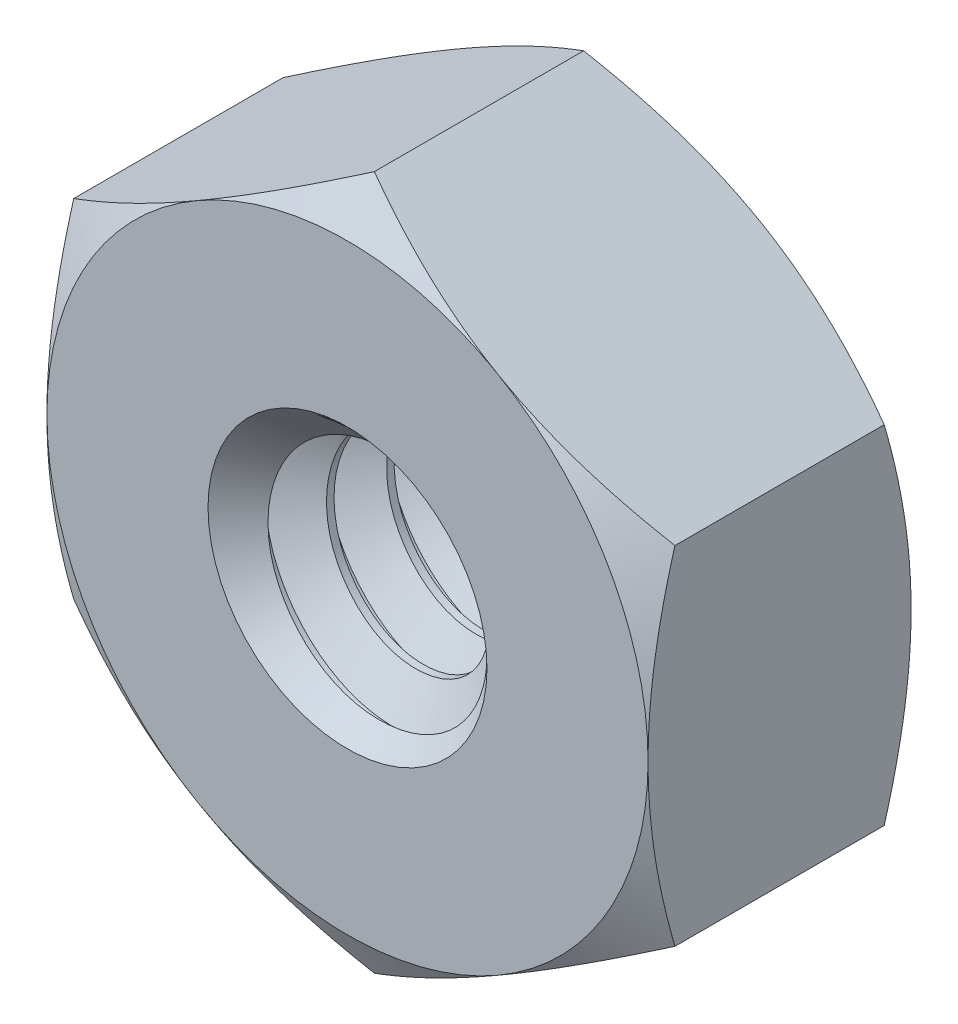
from build123d import *

# Parameters (mm, degrees)
EXTRUDE1_DEPTH     = 2.778125
SKETCH2_OUTSIDE_W  = 33.194
SKETCH2_OUTSIDE_H  = 34.176
SKETCH2_OUTSIDE_R  = 3.175
CUT_EXTRUDE6_DEPTH = 6.589225067
CUT_EXTRUDE6_DRAFT = -60
SKETCH4_OUTSIDE_W  = 32.366
SKETCH4_OUTSIDE_H  = 33.348
SKETCH4_OUTSIDE_R  = 3.175
CUT_EXTRUDE3_DEPTH = 6.35
CUT_EXTRUDE3_DRAFT = -60
SKETCH5_R          = 1.4224
CUT_EXTRUDE4_DEPTH = 6.589225067
SWEEP1_PITCH       = 0.635
SKETCH8_R          = 1.9304
CUT_EXTRUDE5_DEPTH = 8.990379213
CUT_EXTRUDE8_DEPTH = 6.589225173


with BuildPart() as part:
    # Sketch1 → Extrude1 (new body)
    with BuildSketch(Plane.XY):
        Polygon((0, 3.666174209), (-3.175, 1.833087105), (-3.175, -1.833087105), (0, -3.666174209), (3.175, -1.833087105), (3.175, 1.833087105), align=None)
    extrude(amount=-EXTRUDE1_DEPTH)


with BuildPart() as cut_extrude6_tool:
    # Sketch2 outside → Cut-Extrude6 (with draft: the straight prism first)
    with BuildSketch(Plane.XY):
        Rectangle(SKETCH2_OUTSIDE_W, SKETCH2_OUTSIDE_H)
        Circle(SKETCH2_OUTSIDE_R, mode=Mode.SUBTRACT)
    extrude(amount=-CUT_EXTRUDE6_DEPTH)
    # Cut-Extrude6: the draft: its side faces are tilted about the plane it starts from
    cut_extrude6_sides = [cut_extrude6_tool.faces().sort_by_distance(p)[0] for p in [
        (0, -17.088, -3.294612533),
        (16.597, 0, -3.294612533),
        (0, 17.088, -3.294612533),
        (-16.597, 0, -3.294612533),
        (-3.175, 0, -3.294612533),
    ]]
    draft(cut_extrude6_sides, Plane.XY, CUT_EXTRUDE6_DRAFT)


with BuildPart() as part_1:
    add(part.part)

    # Cut-Extrude6: cut by cut_extrude6_tool
    add(cut_extrude6_tool.part, mode=Mode.SUBTRACT)


with BuildPart() as cut_extrude3_tool:
    # Sketch4 outside → Cut-Extrude3 (with draft: the straight prism first)
    with BuildSketch(Plane(origin=(0, 0, -2.778125), x_dir=(-1, 0, 0), z_dir=(0, 0, -1))):
        Rectangle(SKETCH4_OUTSIDE_W, SKETCH4_OUTSIDE_H)
        Circle(SKETCH4_OUTSIDE_R, mode=Mode.SUBTRACT)
    extrude(amount=-CUT_EXTRUDE3_DEPTH)
    # Cut-Extrude3: the draft: its side faces are tilted about the plane it starts from
    cut_extrude3_sides = [cut_extrude3_tool.faces().sort_by_distance(p)[0] for p in [
        (0, -16.674, 0.396875),
        (-16.183, 0, 0.396875),
        (0, 16.674, 0.396875),
        (16.183, 0, 0.396875),
        (3.175, 0, 0.396875),
    ]]
    draft(cut_extrude3_sides, Plane(origin=(0, 0, -2.778125), x_dir=(-1, 0, 0), z_dir=(0, 0, -1)), CUT_EXTRUDE3_DRAFT)


with BuildPart() as part_2:
    add(part_1.part)

    # Cut-Extrude3: cut by cut_extrude3_tool
    add(cut_extrude3_tool.part, mode=Mode.SUBTRACT)

    # Sketch5 → Cut-Extrude4 (cut, through all)
    with BuildSketch(Plane.XY):
        Circle(SKETCH5_R)
    extrude(amount=-CUT_EXTRUDE4_DEPTH, mode=Mode.SUBTRACT)

    # Sweep1: the profile of Sketch7 profile screwed along a right-hand helix of 14.375 turns, 6 arcs to a turn; built about Z, then put on its axis
    sweep1_z = Axis((0, 0, 0), (0, 0, 1))
    sweep1_corners = [(1.4227, 0, -0.555798205), (1.4227, 0, 0.000173205), (1.009955401, 0, -0.238125), (1.009955401, 0, -0.3175)]
    with BuildLine(mode=Mode.PRIVATE) as sweep1_profile:
        Line(sweep1_corners[0], sweep1_corners[1])
        Line(sweep1_corners[1], sweep1_corners[2])
        Line(sweep1_corners[2], sweep1_corners[3])
        Line(sweep1_corners[3], sweep1_corners[0])
    sweep1_cap = Face(sweep1_profile.wire())
    sweep1_turn_angles = [0, 30, 60, 90, 120, 150, 180, 210, 240, 270, 300, 330, 360]
    sweep1_turn_weights = [1, 0.8660254037844387, 1, 0.8660254037844387, 1, 0.8660254037844387, 1, 0.8660254037844387, 1, 0.8660254037844387, 1, 0.8660254037844387, 1]
    sweep1_turn_rails = [Edge.make_bspline([Vector(p[0], p[1], 0).rotate(sweep1_z, sweep1_turn_angles[k]) / sweep1_turn_weights[k] + Vector(0, 0, p[2] + SWEEP1_PITCH * sweep1_turn_angles[k] / 360) for k in range(13)], [0, 0, 0, 1, 1, 2, 2, 3, 3, 4, 4, 5, 5, 6, 6, 6], 2, sweep1_turn_weights) for p in sweep1_corners]
    sweep1_turn_sides = [Face.make_surface_from_curves(sweep1_turn_rails[p[0]], sweep1_turn_rails[p[1]]) for p in [(0, 1), (1, 2), (2, 3), (3, 0)]]
    sweep1_turn = Solid(Shell([*sweep1_turn_sides, sweep1_cap, sweep1_cap.rotate(sweep1_z, 360).moved(Location((0, 0, SWEEP1_PITCH * 360 / 360)))]))
    sweep1_last_angles = [5040, 5070, 5100, 5130, 5160, 5167.5, 5175]
    sweep1_last_weights = [1, 0.8660254037844387, 1, 0.8660254037844387, 1, 0.9914448613738001, 1]
    sweep1_last_rails = [Edge.make_bspline([Vector(p[0], p[1], 0).rotate(sweep1_z, sweep1_last_angles[k]) / sweep1_last_weights[k] + Vector(0, 0, p[2] + SWEEP1_PITCH * sweep1_last_angles[k] / 360) for k in range(7)], [0, 0, 0, 1, 1, 2, 2, 3, 3, 3], 2, sweep1_last_weights) for p in sweep1_corners]
    sweep1_last_sides = [Face.make_surface_from_curves(sweep1_last_rails[p[0]], sweep1_last_rails[p[1]]) for p in [(0, 1), (1, 2), (2, 3), (3, 0)]]
    sweep1_last = Solid(Shell([*sweep1_last_sides, sweep1_cap.rotate(sweep1_z, 5040).moved(Location((0, 0, SWEEP1_PITCH * 5040 / 360))), sweep1_cap.rotate(sweep1_z, 5175).moved(Location((0, 0, SWEEP1_PITCH * 5175 / 360)))]))
    sweep1_each = [*[sweep1_turn.moved(Location((0, 0, SWEEP1_PITCH * i))) for i in range(14)], sweep1_last]
    add(Plane(origin=(0, 0, 0), x_dir=(0, 1, 0), z_dir=(0, 0, -1)) * Compound([sweep1_each[i] for i in range(0, 15, 2)]))
    add(Plane(origin=(0, 0, 0), x_dir=(0, 1, 0), z_dir=(0, 0, -1)) * Compound([sweep1_each[i] for i in range(1, 15, 2)]))

    # Sketch8 → Cut-Extrude5 (cut, through all)
    with BuildSketch(Plane(origin=(0, 0, -2.778125), x_dir=(-1, 0, 0), z_dir=(0, 0, -1))):
        Circle(SKETCH8_R)
    extrude(amount=CUT_EXTRUDE5_DEPTH, mode=Mode.SUBTRACT)

    # Sketch10 → Cut-Extrude8 (cut, through all)
    with BuildSketch(Plane.XY):
        with BuildLine():
            ThreePointArc((1.5875, -2.749630657), (2.749630657, -1.5875), (3.175, 0))
            ThreePointArc((3.175, 0), (2.749630657, 1.5875), (1.5875, 2.749630657))
            ThreePointArc((1.5875, 2.749630657), (0, 3.175), (-1.5875, 2.749630657))
            ThreePointArc((-1.5875, 2.749630657), (-2.749630657, 1.5875), (-3.175, 0))
            ThreePointArc((-3.175, 0), (-2.749630657, -1.5875), (-1.5875, -2.749630657))
            ThreePointArc((-1.5875, -2.749630657), (0, -3.175), (1.5875, -2.749630657))
        make_face()
    extrude(amount=CUT_EXTRUDE8_DEPTH, mode=Mode.SUBTRACT)

    # Cut-Extrude7 cone 1 section (through the dimple's axis) → Cut-Extrude7 (revolve, cut)
    with BuildSketch(Plane(origin=(0, 0, -2.778125), x_dir=(0, 1, 0), z_dir=(1, 0, 0))):
        Polygon((0, 0), (1.4732, 0), (0, 1.4732), align=None)
    revolve(axis=Axis((0, 0, -2.778125), (0, 0, 1)), mode=Mode.SUBTRACT)

    # Cut-Extrude9 cone 1 section (through the dimple's axis) → Cut-Extrude9 (revolve, cut)
    with BuildSketch(Plane(origin=(0, 0, 0), x_dir=(0, -1, 0), z_dir=(1, 0, 0))):
        Polygon((0, 0), (1.4732, 0), (0, 1.4732), align=None)
    revolve(axis=Axis((0, 0, 0), (0, 0, -1)), mode=Mode.SUBTRACT)


solid = part_2.part
